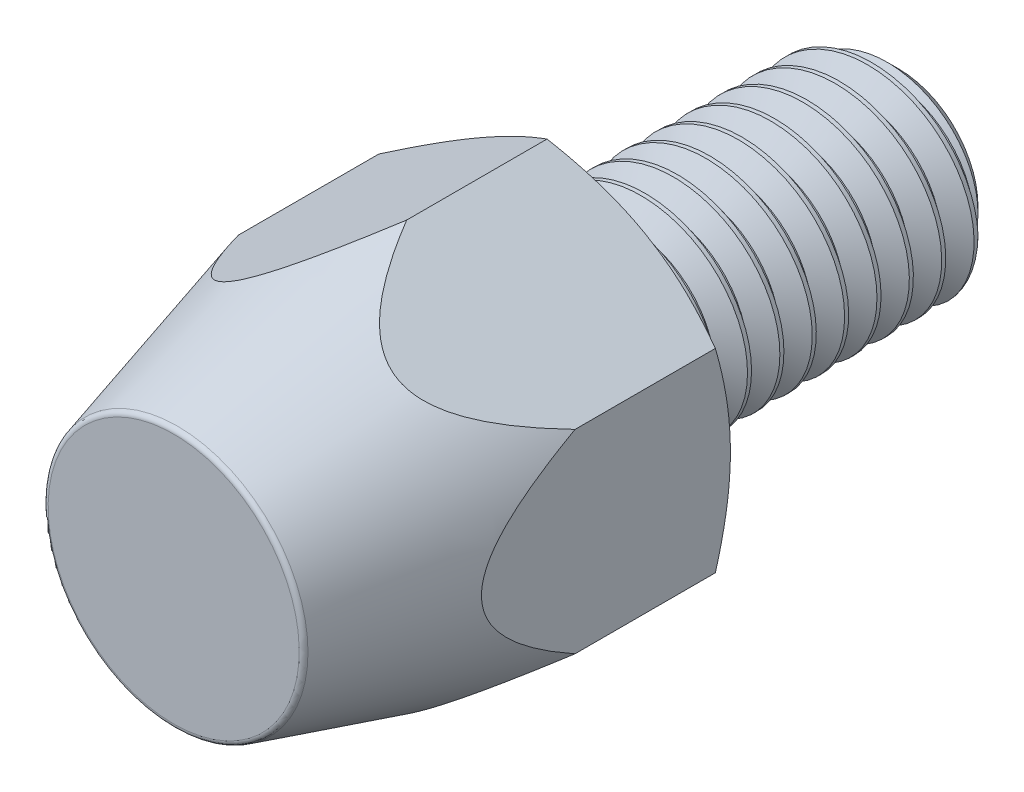
from build123d import *

# Parameters (mm, degrees)
BOSS_EXTRUDE1_DEPTH = 15
SKETCH4_OUTSIDE_W   = 87.644
SKETCH4_OUTSIDE_H   = 89.656
SKETCH4_OUTSIDE_R   = 6.5
CUT_EXTRUDE1_DEPTH  = 18.988422202
CUT_EXTRUDE1_DRAFT  = -60
SKETCH5_OUTSIDE_W   = 128.242
SKETCH5_OUTSIDE_H   = 130.254
SKETCH5_OUTSIDE_R   = 6.5
CUT_EXTRUDE2_DEPTH  = 30.708304114
CUT_EXTRUDE2_DRAFT  = -60
CHAMFER1_SIZE       = 0.9375
FILLET1_R           = 0.2
CUT_SWEEP1_PITCH    = 1.25
CUT_SWEEP1_TO       = 13


with BuildPart() as part:
    # Sketch2 → Revolve1 (revolve)
    with BuildSketch(Plane(origin=(0, 0, 0), x_dir=(0, 0, -1), z_dir=(1, 0, 0))):
        Polygon((28, 4), (28, 0), (0, 0), (0, 6.5), (15, 6.5), (15, 4), align=None)
    revolve(axis=Axis((0, 0, -28), (0, 0, 1)))

    # Sketch3 → Boss-Extrude1 (add)
    with BuildSketch(Plane.XY):
        Polygon((0, 7.505553499), (-6.5, 3.75277675), (-6.5, -3.75277675), (0, -7.505553499), (6.5, -3.75277675), (6.5, 3.75277675), align=None)
    extrude(amount=-BOSS_EXTRUDE1_DEPTH)


with BuildPart() as cut_extrude1_tool:
    # Sketch4 outside → Cut-Extrude1 (with draft: the straight prism first)
    with BuildSketch(Plane(origin=(0, 0, -15), x_dir=(-1, 0, 0), z_dir=(0, 0, -1))):
        Rectangle(SKETCH4_OUTSIDE_W, SKETCH4_OUTSIDE_H)
        Circle(SKETCH4_OUTSIDE_R, mode=Mode.SUBTRACT)
    extrude(amount=-CUT_EXTRUDE1_DEPTH)
    # Cut-Extrude1: the draft: its side faces are tilted about the plane it starts from
    cut_extrude1_sides = [cut_extrude1_tool.faces().sort_by_distance(p)[0] for p in [
        (0, -44.828, -5.505788899),
        (-43.822, 0, -5.505788899),
        (0, 44.828, -5.505788899),
        (43.822, 0, -5.505788899),
        (6.5, 0, -5.505788899),
    ]]
    draft(cut_extrude1_sides, Plane(origin=(0, 0, -15), x_dir=(-1, 0, 0), z_dir=(0, 0, -1)), CUT_EXTRUDE1_DRAFT)


with BuildPart() as part_1:
    add(part.part)

    # Cut-Extrude1: cut by cut_extrude1_tool
    add(cut_extrude1_tool.part, mode=Mode.SUBTRACT)


with BuildPart() as cut_extrude2_tool:
    # Sketch5 outside → Cut-Extrude2 (with draft: the straight prism first)
    with BuildSketch(Plane.XY):
        Rectangle(SKETCH5_OUTSIDE_W, SKETCH5_OUTSIDE_H)
        Circle(SKETCH5_OUTSIDE_R, mode=Mode.SUBTRACT)
    extrude(amount=-CUT_EXTRUDE2_DEPTH)
    # Cut-Extrude2: the draft: its side faces are tilted about the plane it starts from
    cut_extrude2_sides = [cut_extrude2_tool.faces().sort_by_distance(p)[0] for p in [
        (0, -65.127, -15.354152057),
        (64.121, 0, -15.354152057),
        (0, 65.127, -15.354152057),
        (-64.121, 0, -15.354152057),
        (-6.5, 0, -15.354152057),
    ]]
    draft(cut_extrude2_sides, Plane.XY, CUT_EXTRUDE2_DRAFT)


with BuildPart() as part_2:
    add(part_1.part)

    # Cut-Extrude2: cut by cut_extrude2_tool
    add(cut_extrude2_tool.part, mode=Mode.SUBTRACT)


with BuildPart() as body_2:
    # Split1: read off the stored shape, not the designer's step
    # Split1: the piece on the far side of the plane
    add(part_2.part)
    split(bisect_by=Plane.XY.offset(-15), keep=Keep.BOTTOM)

    # Chamfer1
    chamfer1_edges = [body_2.edges().sort_by_distance(p)[0] for p in [
        (0, -4, -28),
    ]]
    chamfer(chamfer1_edges, length=CHAMFER1_SIZE)

    # Cut-Sweep1: arcs per turn and ends read off the stored shape
    # Cut-Sweep1: the profile of Sketch6 screwed along a right-hand helix through 11.4 turns, 8 arcs to a turn; built about Z, then put on its axis
    cut_sweep1_z = Axis((0, 0, 0), (0, 0, 1))
    cut_sweep1_corners = [(3.188101184, 0, -0.46875), (3.188101184, 0, -0.625), (4.067658235, 0, -1.1328125), (4.067658235, 0, 0.0390625)]
    with BuildLine(mode=Mode.PRIVATE) as cut_sweep1_profile:
        Line(cut_sweep1_corners[0], cut_sweep1_corners[1])
        Line(cut_sweep1_corners[1], cut_sweep1_corners[2])
        Line(cut_sweep1_corners[2], cut_sweep1_corners[3])
        Line(cut_sweep1_corners[3], cut_sweep1_corners[0])
    cut_sweep1_cap = Face(cut_sweep1_profile.wire())
    cut_sweep1_turn_angles = [0, 22.5, 45, 67.5, 90, 112.5, 135, 157.5, 180, 202.5, 225, 247.5, 270, 292.5, 315, 337.5, 360]
    cut_sweep1_turn_weights = [1, 0.9238795325112867, 1, 0.9238795325112867, 1, 0.9238795325112867, 1, 0.9238795325112867, 1, 0.9238795325112867, 1, 0.9238795325112867, 1, 0.9238795325112867, 1, 0.9238795325112867, 1]
    cut_sweep1_turn_rails = [Edge.make_bspline([Vector(p[0], p[1], 0).rotate(cut_sweep1_z, cut_sweep1_turn_angles[k]) / cut_sweep1_turn_weights[k] + Vector(0, 0, p[2] + CUT_SWEEP1_PITCH * cut_sweep1_turn_angles[k] / 360) for k in range(17)], [0, 0, 0, 1, 1, 2, 2, 3, 3, 4, 4, 5, 5, 6, 6, 7, 7, 8, 8, 8], 2, cut_sweep1_turn_weights) for p in cut_sweep1_corners]
    cut_sweep1_turn_sides = [Face.make_surface_from_curves(cut_sweep1_turn_rails[p[0]], cut_sweep1_turn_rails[p[1]]) for p in [(0, 1), (1, 2), (2, 3), (3, 0)]]
    cut_sweep1_last_angles = [3960, 3982.5, 4005, 4027.5, 4050, 4072.5, 4095, 4099.5, 4104]
    cut_sweep1_last_weights = [1, 0.9238795325112867, 1, 0.9238795325112867, 1, 0.9238795325112867, 1, 0.9969173337331024, 1]
    cut_sweep1_last_rails = [Edge.make_bspline([Vector(p[0], p[1], 0).rotate(cut_sweep1_z, cut_sweep1_last_angles[k]) / cut_sweep1_last_weights[k] + Vector(0, 0, p[2] + CUT_SWEEP1_PITCH * cut_sweep1_last_angles[k] / 360) for k in range(9)], [0, 0, 0, 1, 1, 2, 2, 3, 3, 4, 4, 4], 2, cut_sweep1_last_weights) for p in cut_sweep1_corners]
    cut_sweep1_last_sides = [Face.make_surface_from_curves(cut_sweep1_last_rails[p[0]], cut_sweep1_last_rails[p[1]]) for p in [(0, 1), (1, 2), (2, 3), (3, 0)]]
    cut_sweep1 = Plane(origin=(0, 0, -28), x_dir=(0, 1, 0), z_dir=(0, 0, 1)) * split(Solid(Shell([*[p.moved(Location((0, 0, CUT_SWEEP1_PITCH * i))) for i in range(11) for p in cut_sweep1_turn_sides], *cut_sweep1_last_sides, cut_sweep1_cap, cut_sweep1_cap.rotate(cut_sweep1_z, 4104).moved(Location((0, 0, CUT_SWEEP1_PITCH * 4104 / 360)))])), bisect_by=Plane.XY.offset(CUT_SWEEP1_TO), keep=Keep.BOTTOM, mode=Mode.PRIVATE)
    add(cut_sweep1, mode=Mode.SUBTRACT)

    # Sketch9 → Cut-Revolve3 (revolve, cut)
    with BuildSketch(Plane(origin=(0, 0, 0), x_dir=(0, 0, -1), z_dir=(1, 0, 0)), mode=Mode.PRIVATE) as cut_revolve3_sk:
        Polygon((15, 3.188101184), (15.34375, 3.188101184), (15.8125, 4), (15, 4), align=None)
    revolve(cut_revolve3_sk.sketch.rotate(Axis((0, 0, -28), (0, 0, 1)), 170.947534291), axis=Axis((0, 0, -28), (0, 0, 1)), mode=Mode.SUBTRACT)


with BuildPart() as part_3:
    add(part_2.part)

    # Split1
    split(bisect_by=Plane.XY.offset(-15), keep=Keep.TOP)

    # Sketch11 → Cut-Revolve4 (revolve, cut)
    with BuildSketch(Plane(origin=(0, 0, 0), x_dir=(0, 0, -1), z_dir=(1, 0, 0))):
        Polygon((0, 5), (9, 7.505553499), (9, 9.527986853), (0, 9.527986853), align=None)
    revolve(axis=Axis((0, 0, -28), (0, 0, 1)), mode=Mode.SUBTRACT)

    # Fillet1
    fillet1_edges = [part_3.edges().sort_by_distance(p)[0] for p in [
        (0, -5, 0),
    ]]
    fillet(fillet1_edges, radius=FILLET1_R)

    # Combine1: union body 2
    add(body_2.part)


solid = part_3.part
